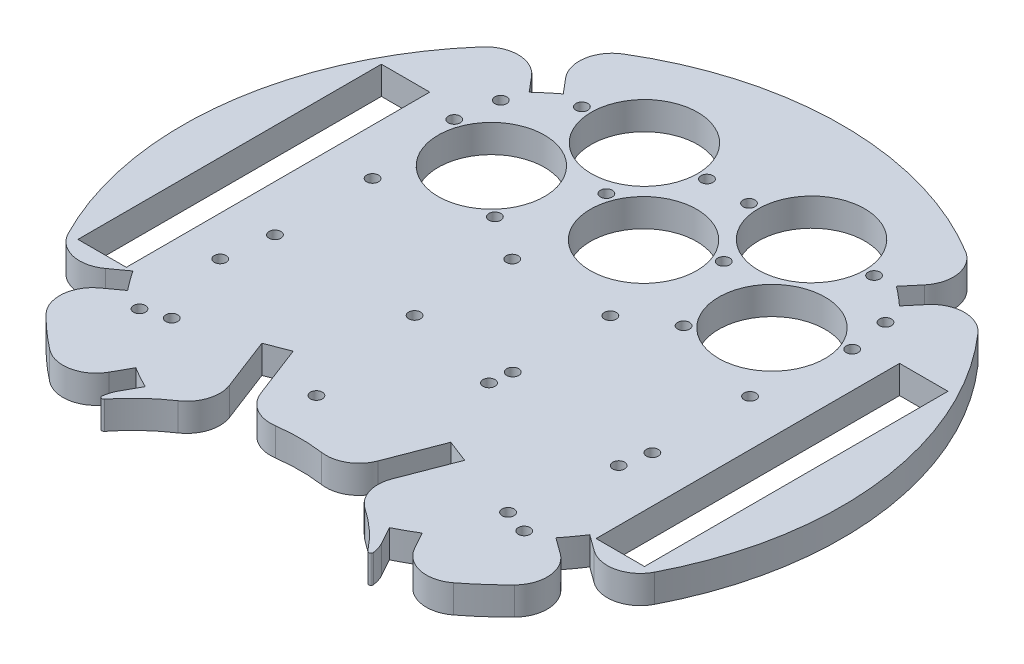
from build123d import *

# Parameters (mm, degrees)
BOSS_EXTRUDE3_OUTLINE_R   = 1.35
BOSS_EXTRUDE3_OUTLINE_W   = 11
BOSS_EXTRUDE3_OUTLINE_H   = 69
BOSS_EXTRUDE3_OUTLINE_R_2 = 12.095
BOSS_EXTRUDE3_DEPTH       = 6.35
FILLET5_R                 = 0.5


# Read off the part's stored shape, not the designer's step: Boss-Extrude3
with BuildPart() as part:
    # Boss-Extrude3 outline → Boss-Extrude3 (new body)
    with BuildSketch(Plane(origin=(0, 0, 0), x_dir=(1, 0, 0), z_dir=(0, 1, 0))):
        with BuildLine():
            ThreePointArc((30.845959646, -64.038266509), (30.722917613, -61.793165345), (29.939937248, -59.685427143))
            Line((29.939937248, -59.685427143), (27.754427747, -55.742664454))
            ThreePointArc((27.754427747, -55.742664454), (30.189085526, -54.462574444), (32.564835967, -53.076212737))
            Line((32.564835967, -53.076212737), (34.750345491, -57.018976288))
            ThreePointArc((34.750345491, -57.018976288), (39.797694407, -60.728851606), (45.899993549, -59.314337155))
            ThreePointArc((45.899993549, -59.314337155), (49.682691748, -56.183895741), (53.252452412, -52.812652955))
            ThreePointArc((53.252452412, -52.812652955), (55.400241506, -46.895968251), (52.284336639, -41.426846498))
            Line((52.284336639, -41.426846498), (48.694399386, -38.812476969))
            ThreePointArc((48.694399386, -38.812476969), (50.363701809, -36.620355543), (51.934395763, -34.35653412))
            Line((51.934395763, -34.35653412), (55.532494673, -36.970706015))
            ThreePointArc((55.532494673, -36.970706015), (61.694807292, -38.244055423), (66.658022594, -34.375979751))
            ThreePointArc((66.658022594, -34.375979751), (74.442134424, 9.130641951), (56.374397975, 49.466425512))
            ThreePointArc((56.374397975, 49.466425512), (50.654117331, 52.01932544), (44.991624855, 49.340690033))
            Line((44.991624855, 49.340690033), (42.093955335, 45.887381973))
            ThreePointArc((42.093955335, 45.887381973), (40.026384455, 47.701587473), (37.880710897, 49.422713826))
            Line((37.880710897, 49.422713826), (40.778380417, 52.876021886))
            ThreePointArc((40.778380417, 52.876021886), (42.433039833, 58.917628535), (38.925607882, 64.107698843))
            ThreePointArc((38.925607882, 64.107698843), (0, 75), (-38.925607882, 64.107698843))
            ThreePointArc((-38.925607882, 64.107698843), (-42.433039833, 58.917628535), (-40.778380417, 52.876021886))
            Line((-40.778380417, 52.876021886), (-37.880710897, 49.422713826))
            ThreePointArc((-37.880710897, 49.422713826), (-40.026384455, 47.701587473), (-42.093955335, 45.887381973))
            Line((-42.093955335, 45.887381973), (-44.991624855, 49.340690033))
            ThreePointArc((-44.991624855, 49.340690033), (-50.654117331, 52.01932544), (-56.374397975, 49.466425512))
            ThreePointArc((-56.374397975, 49.466425512), (-74.442134424, 9.130641951), (-66.658022831, -34.375979873))
            ThreePointArc((-66.658022831, -34.375979873), (-61.694807292, -38.244055423), (-55.532494673, -36.970706015))
            Line((-55.532494673, -36.970706015), (-51.934395763, -34.35653412))
            ThreePointArc((-51.934395763, -34.35653412), (-50.363701809, -36.620355543), (-48.694399386, -38.812476969))
            Line((-48.694399386, -38.812476969), (-52.284336639, -41.426846498))
            ThreePointArc((-52.284336639, -41.426846498), (-55.400241506, -46.895968251), (-53.252452412, -52.812652955))
            ThreePointArc((-53.252452412, -52.812652955), (-49.682691748, -56.183895741), (-45.899993549, -59.314337155))
            ThreePointArc((-45.899993549, -59.314337155), (-39.797694407, -60.728851606), (-34.750345491, -57.018976288))
            Line((-34.750345491, -57.018976288), (-32.564835967, -53.076212737))
            ThreePointArc((-32.564835967, -53.076212737), (-30.189085526, -54.462574444), (-27.754427747, -55.742664454))
            Line((-27.754427747, -55.742664454), (-29.939937248, -59.685427143))
            ThreePointArc((-29.939937248, -59.685427143), (-30.722917613, -61.793165345), (-30.845959646, -64.038266509))
            ThreePointArc((-30.845959646, -64.038266509), (-26.466137741, -58.99482374), (-21.272807595, -54.79381471))
            ThreePointArc((-21.272807595, -54.79381471), (-18.309924074, -50.834725832), (-18.455489673, -45.891864903))
            Line((-18.455489673, -45.891864903), (-23.054134296, -33.922453045))
            Line((-23.054134296, -33.922453045), (-17.920018766, -31.949927322))
            Line((-17.920018766, -31.949927322), (-13.321374143, -43.91933918))
            ThreePointArc((-13.321374143, -43.91933918), (-10.119925368, -47.688130663), (-5.268365652, -48.644912678))
            ThreePointArc((-5.268365652, -48.644912678), (0, -48.279128696), (5.268365652, -48.644912678))
            ThreePointArc((5.268365652, -48.644912678), (10.119925368, -47.688130663), (13.321374143, -43.91933918))
            Line((13.321374143, -43.91933918), (17.920018766, -31.949927322))
            Line((17.920018766, -31.949927322), (23.054134296, -33.922453045))
            Line((23.054134296, -33.922453045), (18.455489673, -45.891864903))
            ThreePointArc((18.455489673, -45.891864903), (18.309924074, -50.834725832), (21.272807595, -54.79381471))
            ThreePointArc((21.272807595, -54.79381471), (26.466137741, -58.99482374), (30.845959646, -64.038266509))
        make_face()
        with Locations((-43.735655662, -41.075447944)):
            Circle(BOSS_EXTRUDE3_OUTLINE_R, mode=Mode.SUBTRACT)
        with Locations((-38.234289702, -39.23697625)):
            Circle(BOSS_EXTRUDE3_OUTLINE_R, mode=Mode.SUBTRACT)
        with Locations((-6.55476095, -38.026099982)):
            Circle(BOSS_EXTRUDE3_OUTLINE_R, mode=Mode.SUBTRACT)
        with Locations((-44.385223141, -22.074211772)):
            Circle(BOSS_EXTRUDE3_OUTLINE_R, mode=Mode.SUBTRACT)
        with Locations((-58.910067426, 0.102907352)):
            Rectangle(BOSS_EXTRUDE3_OUTLINE_W, BOSS_EXTRUDE3_OUTLINE_H, mode=Mode.SUBTRACT)
        with Locations((-42.910067426, -11.1)):
            Circle(BOSS_EXTRUDE3_OUTLINE_R, mode=Mode.SUBTRACT)
        with Locations((-11.160067426, -11.1)):
            Circle(BOSS_EXTRUDE3_OUTLINE_R, mode=Mode.SUBTRACT)
        with Locations((38.234289702, -39.23697625)):
            Circle(BOSS_EXTRUDE3_OUTLINE_R, mode=Mode.SUBTRACT)
        with Locations((43.735655662, -41.075447944)):
            Circle(BOSS_EXTRUDE3_OUTLINE_R, mode=Mode.SUBTRACT)
        with Locations((10.597026674, -15.930038136)):
            Circle(BOSS_EXTRUDE3_OUTLINE_R, mode=Mode.SUBTRACT)
        with Locations((11.160067426, -11.1)):
            Circle(BOSS_EXTRUDE3_OUTLINE_R, mode=Mode.SUBTRACT)
        with Locations((41.601681906, -17.457756634)):
            Circle(BOSS_EXTRUDE3_OUTLINE_R, mode=Mode.SUBTRACT)
        with Locations((42.910067426, -11.1)):
            Circle(BOSS_EXTRUDE3_OUTLINE_R, mode=Mode.SUBTRACT)
        with Locations((58.910067426, 0.102907352)):
            Rectangle(BOSS_EXTRUDE3_OUTLINE_W, BOSS_EXTRUDE3_OUTLINE_H, mode=Mode.SUBTRACT)
        with Locations((-42.910067426, 11.1)):
            Circle(BOSS_EXTRUDE3_OUTLINE_R, mode=Mode.SUBTRACT)
        with Locations((-45.242610731, 31.997163897)):
            Circle(BOSS_EXTRUDE3_OUTLINE_R, mode=Mode.SUBTRACT)
        with Locations((-21.451773633, 17.449398418)):
            Circle(BOSS_EXTRUDE3_OUTLINE_R, mode=Mode.SUBTRACT)
        with Locations((-11.160067426, 11.1)):
            Circle(BOSS_EXTRUDE3_OUTLINE_R, mode=Mode.SUBTRACT)
        with Locations((-31.895736851, 27.096933482)):
            Circle(BOSS_EXTRUDE3_OUTLINE_R_2, mode=Mode.SUBTRACT)
        with Locations((-13.346873881, 34.693819966)):
            Circle(BOSS_EXTRUDE3_OUTLINE_R, mode=Mode.SUBTRACT)
        with Locations((-43.735655662, 41.075447944)):
            Circle(BOSS_EXTRUDE3_OUTLINE_R, mode=Mode.SUBTRACT)
        with Locations((-33.21799214, 49)):
            Circle(BOSS_EXTRUDE3_OUTLINE_R, mode=Mode.SUBTRACT)
        with Locations((-19, 49)):
            Circle(BOSS_EXTRUDE3_OUTLINE_R_2, mode=Mode.SUBTRACT)
        with Locations((-4.78200786, 49)):
            Circle(BOSS_EXTRUDE3_OUTLINE_R, mode=Mode.SUBTRACT)
        with Locations((11.160067426, 11.1)):
            Circle(BOSS_EXTRUDE3_OUTLINE_R, mode=Mode.SUBTRACT)
        with Locations((21.451773633, 17.449398418)):
            Circle(BOSS_EXTRUDE3_OUTLINE_R, mode=Mode.SUBTRACT)
        with Locations((0, 29.793589551)):
            Circle(BOSS_EXTRUDE3_OUTLINE_R_2, mode=Mode.SUBTRACT)
        with Locations((13.346873881, 34.693819966)):
            Circle(BOSS_EXTRUDE3_OUTLINE_R, mode=Mode.SUBTRACT)
        with Locations((31.895736851, 27.096933482)):
            Circle(BOSS_EXTRUDE3_OUTLINE_R_2, mode=Mode.SUBTRACT)
        with Locations((42.910067426, 11.1)):
            Circle(BOSS_EXTRUDE3_OUTLINE_R, mode=Mode.SUBTRACT)
        with Locations((45.242610731, 31.997163897)):
            Circle(BOSS_EXTRUDE3_OUTLINE_R, mode=Mode.SUBTRACT)
        with Locations((4.78200786, 49)):
            Circle(BOSS_EXTRUDE3_OUTLINE_R, mode=Mode.SUBTRACT)
        with Locations((19, 49)):
            Circle(BOSS_EXTRUDE3_OUTLINE_R_2, mode=Mode.SUBTRACT)
        with Locations((33.21799214, 49)):
            Circle(BOSS_EXTRUDE3_OUTLINE_R, mode=Mode.SUBTRACT)
        with Locations((43.735655662, 41.075447944)):
            Circle(BOSS_EXTRUDE3_OUTLINE_R, mode=Mode.SUBTRACT)
    extrude(amount=BOSS_EXTRUDE3_DEPTH)

    # Fillet5
    fillet5_edges = [part.edges().sort_by_distance(p)[0] for p in [
        (30.845959646, 3.175, 64.038266509),
        (-30.845959646, 3.175, 64.038266509),
    ]]
    fillet(fillet5_edges, radius=FILLET5_R)


solid = part.part
